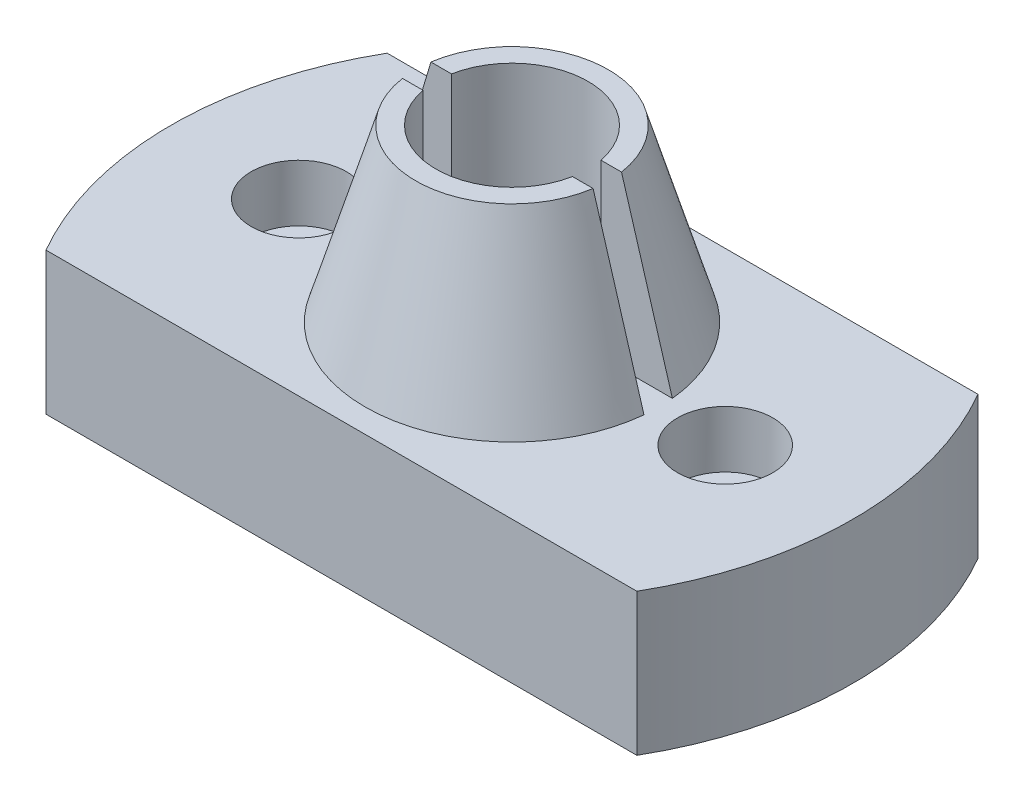
from build123d import *

# Parameters (mm, degrees)
SKETCH1_R           = 12
SKETCH1_R_2         = 2.675
BOSS_EXTRUDE1_DEPTH = 5
SKETCH2_R           = 5.16665
SKETCH2_R_2         = 2.675
BOSS_EXTRUDE2_DEPTH = 6
CHAMFER1_SIZE       = 6
CHAMFER1_SIZE_2     = 1.77728097
SKETCH3_R           = 1.675
CUT_EXTRUDE1_DEPTH  = 6
CUT_EXTRUDE2_DEPTH  = 2.5
SKETCH5_W           = 10.3333
SKETCH5_H           = 1
CUT_EXTRUDE3_DEPTH  = 6
CUT_EXTRUDE4_DEPTH  = 10
BOSS_EXTRUDE3_START = -0.5
SKETCH7_R           = 1.706123363
SKETCH7_R_2         = 1.675
BOSS_EXTRUDE3_DEPTH = 0.5


with BuildPart() as part:
    # Sketch1 → Boss-Extrude1 (new body)
    with BuildSketch(Plane(origin=(0, 0, 0), x_dir=(1, 0, 0), z_dir=(0, 1, 0))):
        with Locations(Location((0, 0, 0), (0, 0, 270))):
            Circle(SKETCH1_R)
        with Locations(Location((0, 0, 0), (0, 0, 270))):
            Circle(SKETCH1_R_2, mode=Mode.SUBTRACT)
    extrude(amount=BOSS_EXTRUDE1_DEPTH)

    # Sketch2 → Boss-Extrude2 (add)
    with BuildSketch(Plane(origin=(0, 5, 0), x_dir=(1, 0, 0), z_dir=(0, 1, 0))):
        with Locations(Location((0, 0, 0), (0, 0, 270))):
            Circle(SKETCH2_R)
        with Locations(Location((0, 0, 0), (0, 0, 270))):
            Circle(SKETCH2_R_2, mode=Mode.SUBTRACT)
    extrude(amount=BOSS_EXTRUDE2_DEPTH)

    # Chamfer1
    # the kernel refuses this chamfer: 6, 1.77728097 mm, written as the material it takes off along each edge
    with BuildSketch(Plane(origin=(0, 11, 0), x_dir=(0, 0, 1), z_dir=(-1, 0, 0))) as chamfer1_piece_1_section:
        Polygon((5.16665, -CHAMFER1_SIZE), (5.16665 - CHAMFER1_SIZE_2, 0), (5.16665, 0), align=None)
    chamfer1_piece_1 = revolve(axis=Axis((0, 11, 0), (0, 1, 0)), mode=Mode.PRIVATE)
    chamfer1_piece_1 = split(chamfer1_piece_1, bisect_by=Plane(origin=(0, 5, -4.298679157), z_dir=(0, 1, 0)), keep=Keep.TOP, mode=Mode.PRIVATE)
    add(chamfer1_piece_1, mode=Mode.SUBTRACT)

    # Sketch3 → Cut-Extrude1 (cut)
    with BuildSketch(Plane(origin=(0, 5, 0), x_dir=(1, 0, 0), z_dir=(0, 1, 0))):
        with Locations(Location((-7.5, 0, 0), (0, 0, 270))):
            Circle(SKETCH3_R)
        with Locations(Location((7.5, 0, 0), (0, 0, 270))):
            Circle(SKETCH3_R)
    extrude(amount=-CUT_EXTRUDE1_DEPTH, mode=Mode.SUBTRACT)

    # Sketch4 → Cut-Extrude2 (cut)
    with BuildSketch(Plane.XZ):
        Polygon((-10.425, -1.688749537), (-7.5, -3.377499075), (-4.575, -1.688749537), (-4.575, 1.688749537), (-7.5, 3.377499075), (-10.425, 1.688749537), align=None)
        Polygon((10.425, 1.688749537), (10.425, -1.688749537), (7.5, -3.377499075), (4.575, -1.688749537), (4.575, 1.688749537), (7.5, 3.377499075), align=None)
    extrude(amount=-CUT_EXTRUDE2_DEPTH, mode=Mode.SUBTRACT)

    # Sketch5 → Cut-Extrude3 (cut)
    with BuildSketch(Plane(origin=(0, 5, 0), x_dir=(1, 0, 0), z_dir=(0, 1, 0))):
        Rectangle(SKETCH5_W, SKETCH5_H)
    extrude(amount=CUT_EXTRUDE3_DEPTH, mode=Mode.SUBTRACT)

    # Sketch6 → Cut-Extrude4 (cut)
    with BuildSketch(Plane.XZ):
        with BuildLine():
            Line((-10.392304845, 6), (10.392304845, 6))
            ThreePointArc((10.392304845, 6), (0, 12), (-10.392304845, 6))
        make_face()
        with BuildLine():
            Line((-10.392304845, -6), (10.392304845, -6))
            ThreePointArc((10.392304845, -6), (0, -12), (-10.392304845, -6))
        make_face()
    extrude(amount=-CUT_EXTRUDE4_DEPTH, mode=Mode.SUBTRACT)

    # Sketch7 → Boss-Extrude3 (add)
    with BuildSketch(Plane.XZ.offset(-2.5).offset(BOSS_EXTRUDE3_START)):
        with Locations((7.5, 0)):
            Circle(SKETCH7_R)
        with Locations(Location((-7.5, 0, 0), (0, 0, 90))):
            Circle(SKETCH7_R_2)
    extrude(amount=BOSS_EXTRUDE3_DEPTH)


solid = part.part
